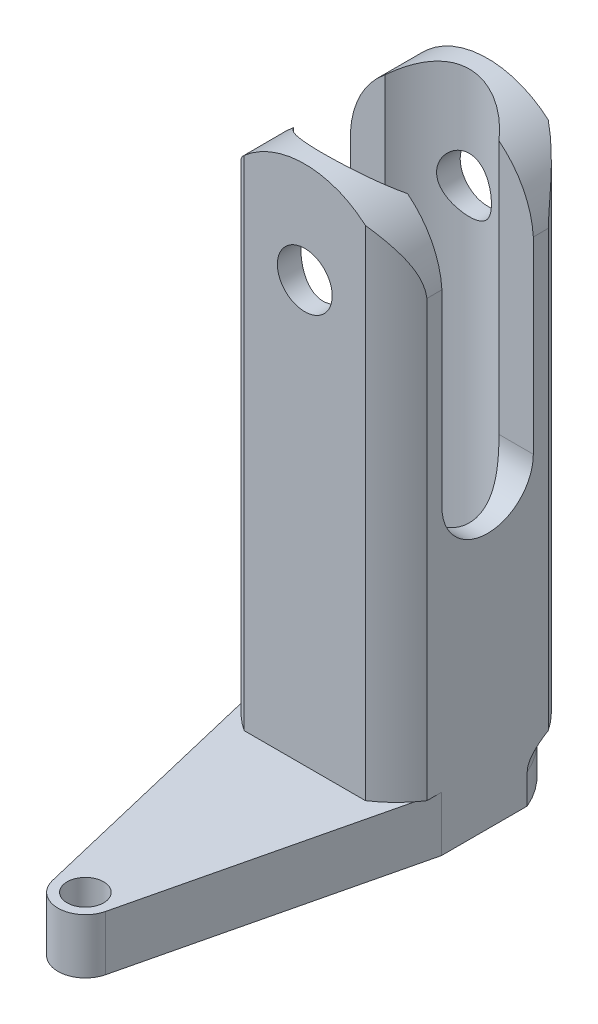
from build123d import *

# Parameters (mm, degrees)
SKETCH1_R           = 6
SKETCH1_R_2         = 2
BOSS_EXTRUDE1_DEPTH = 28.5
SKETCH2_R           = 2
SKETCH2_R_2         = 1
BOSS_EXTRUDE2_DEPTH = 3
SKETCH3_R           = 4
CUT_EXTRUDE1_DEPTH  = 23
SKETCH4_W           = 13
SKETCH4_H           = 13
SKETCH4_W_2         = 10
SKETCH4_H_2         = 10
CUT_EXTRUDE2_DEPTH  = 35.503622998
CUT_EXTRUDE5_DEPTH  = 33.003091855
SKETCH9_W           = 5
SKETCH9_H           = 4.708815116
CUT_EXTRUDE6_DEPTH  = 36.548469223
CUT_EXTRUDE7_DEPTH  = 35.412176554
SKETCH11_R          = 1.5
CUT_EXTRUDE8_DEPTH  = 32.929610206
FILLET1_R           = 2


with BuildPart() as part:
    # Sketch1 → Boss-Extrude1 (new body)
    with BuildSketch(Plane(origin=(0, 0, 0), x_dir=(1, 0, 0), z_dir=(0, 1, 0))):
        with Locations(Location((0, 0, 0), (0, 0, 90))):
            Circle(SKETCH1_R)
        with Locations(Location((0, 0, 0), (0, 0, 90))):
            Circle(SKETCH1_R_2, mode=Mode.SUBTRACT)
    extrude(amount=BOSS_EXTRUDE1_DEPTH)

    # Sketch2 → Boss-Extrude2 (add)
    with BuildSketch(Plane(origin=(0, -3, 0), x_dir=(-1, 0, 0), z_dir=(0, -1, 0))):
        with BuildLine():
            Line((-1.458956227, -17.348492079), (-5.300462758, -1.266089585))
            ThreePointArc((-5.300462758, -1.266089585), (0, 5.449576891), (5.300462758, -1.266089585))
            Line((5.300462758, -1.266089585), (1.458956227, -17.348492079))
            ThreePointArc((1.458956227, -17.348492079), (0, -18.5), (-1.458956227, -17.348492079))
        make_face()
        with Locations(Location((0, 0, 0), (0, 0, 90))):
            Circle(SKETCH2_R, mode=Mode.SUBTRACT)
        with Locations(Location((0, -17, 0), (0, 0, 90))):
            Circle(SKETCH2_R_2, mode=Mode.SUBTRACT)
    extrude(amount=-BOSS_EXTRUDE2_DEPTH)

    # Sketch3 → Cut-Extrude1 (cut)
    with BuildSketch(Plane(origin=(0, 28.5, 0), x_dir=(1, 0, 0), z_dir=(0, 1, 0))):
        with Locations(Location((0, 0, 0), (0, 0, 270))):
            Circle(SKETCH3_R)
    extrude(amount=-CUT_EXTRUDE1_DEPTH, mode=Mode.SUBTRACT)

    # Sketch4 → Cut-Extrude2 (cut, through all)
    with BuildSketch(Plane(origin=(0, 0, 0), x_dir=(1, 0, 0), z_dir=(0, 1, 0))):
        Rectangle(SKETCH4_W, SKETCH4_H)
        Rectangle(SKETCH4_W_2, SKETCH4_H_2, mode=Mode.SUBTRACT)
    extrude(amount=CUT_EXTRUDE2_DEPTH, mode=Mode.SUBTRACT)

    # Sketch8 → Cut-Extrude5 (cut, through all)
    with BuildSketch(Plane.XY.offset(5)):
        with BuildLine():
            Line((-5, 23.791184884), (-6.441511966, 23.791184884))
            Line((-6.441511966, 23.791184884), (-6.441511966, 29.385647876))
            Line((-6.441511966, 29.385647876), (5.988439259, 29.385647876))
            Line((5.988439259, 29.385647876), (5.988439259, 23.791184884))
            Line((5.988439259, 23.791184884), (5, 23.791184884))
            ThreePointArc((5, 23.791184884), (0, 28.5), (-5, 23.791184884))
        make_face()
    extrude(amount=-CUT_EXTRUDE5_DEPTH, mode=Mode.SUBTRACT)

    # Sketch9 → Cut-Extrude6 (cut, through all)
    with BuildSketch(Plane.ZY.offset(5)):
        with Locations((0, 26.145592442)):
            Rectangle(SKETCH9_W, SKETCH9_H)
        with BuildLine():
            Line((2.5, 23.791184884), (-2.5, 23.791184884))
            Line((-2.5, 23.791184884), (-2.5, 13.5))
            ThreePointArc((-2.5, 13.5), (0, 11), (2.5, 13.5))
            Line((2.5, 13.5), (2.5, 23.791184884))
        make_face()
    extrude(amount=-CUT_EXTRUDE6_DEPTH, mode=Mode.SUBTRACT)

    # Sketch10 → Cut-Extrude7 (cut, through all)
    with BuildSketch(Plane(origin=(0, 0, 0), x_dir=(1, 0, 0), z_dir=(0, 1, 0))):
        Polygon((-5, 3.31662479), (-5, -3.31662479), (-6.387377767, -3.31662479), (-6.387377767, 5), (-6.387377767, 6.820918536), (6.983329281, 6.820918536), (6.983329281, -3.31662479), (5, -3.31662479), (5, 5), (-5, 5), align=None)
    extrude(amount=-CUT_EXTRUDE7_DEPTH, mode=Mode.SUBTRACT)

    # Sketch11 → Cut-Extrude8 (cut, through all)
    with BuildSketch(Plane.XY.offset(5)):
        with Locations((0, 23)):
            Circle(SKETCH11_R)
    extrude(amount=-CUT_EXTRUDE8_DEPTH, mode=Mode.SUBTRACT)

    # Fillet1
    # the kernel refuses this fillet: 2 mm, written as the material it adds along each edge
    with BuildSketch(Plane(origin=(0, 0, 0), x_dir=(0.9752052541729319, 0, 0.22130230959822164), z_dir=(-0.22130230959822164, 0, 0.9752052541729319))) as fillet1_piece_1_section:
        with BuildLine():
            CenterArc((7.449576891, -1.377942973), FILLET1_R, 136.451251834, 43.548748166)
            Line((5.449576891, -1.377942973), (5.409576891, -1.377942973))
            Line((5.409576891, -1.377942973), (5.409576891, 0))
            Line((5.409576891, 0), (5.449576891, 0.04))
            ThreePointArc((5.449576891, 0.04), (5.724788445, 0.04), (5.971008462, 0.027558859))
            Line((5.971008462, 0.027558859), (6, 0))
        make_face()
    fillet1_piece_1 = revolve(axis=Axis((0, 0, 0), (0, 1, 0)), revolution_arc=115.571070831, mode=Mode.PRIVATE)
    fillet1_piece_1 = split(fillet1_piece_1, bisect_by=Plane(origin=(5, -0.397015398, -3.862769036), z_dir=(-1, 0, 0)), keep=Keep.TOP, mode=Mode.PRIVATE)
    fillet1_piece_1 = split(fillet1_piece_1, bisect_by=Plane(origin=(3.862770037, -0.397015398, -5), z_dir=(0, 0, 1)), keep=Keep.TOP, mode=Mode.PRIVATE)
    add(fillet1_piece_1)
    with BuildSketch(Plane(origin=(0, 0, 0), x_dir=(0.221302309598303, 0, -0.9752052541729136), z_dir=(0.9752052541729136, 0, 0.221302309598303))) as fillet1_piece_2_section:
        with BuildLine():
            CenterArc((7.449576891, -1.377942973), FILLET1_R, 136.451251834, 43.548748166)
            Line((6, 0), (5.971008462, 0.027558859))
            ThreePointArc((5.971008462, 0.027558859), (5.724788445, 0.04), (5.449576891, 0.04))
            Line((5.449576891, 0.04), (5.409576891, 0))
            Line((5.409576891, 0), (5.409576891, -1.377942973))
            Line((5.409576891, -1.377942973), (5.449576891, -1.377942973))
        make_face()
    fillet1_piece_2 = revolve(axis=Axis((0, 0, 0), (0, 1, 0)), revolution_arc=115.571070831, mode=Mode.PRIVATE)
    fillet1_piece_2 = split(fillet1_piece_2, bisect_by=Plane(origin=(-3.862770028, -0.397015251, -5), z_dir=(0, 0, 1)), keep=Keep.TOP, mode=Mode.PRIVATE)
    fillet1_piece_2 = split(fillet1_piece_2, bisect_by=Plane(origin=(-5, -0.397015251, -3.862769283), z_dir=(1, 0, 0)), keep=Keep.TOP, mode=Mode.PRIVATE)
    add(fillet1_piece_2)


solid = part.part
